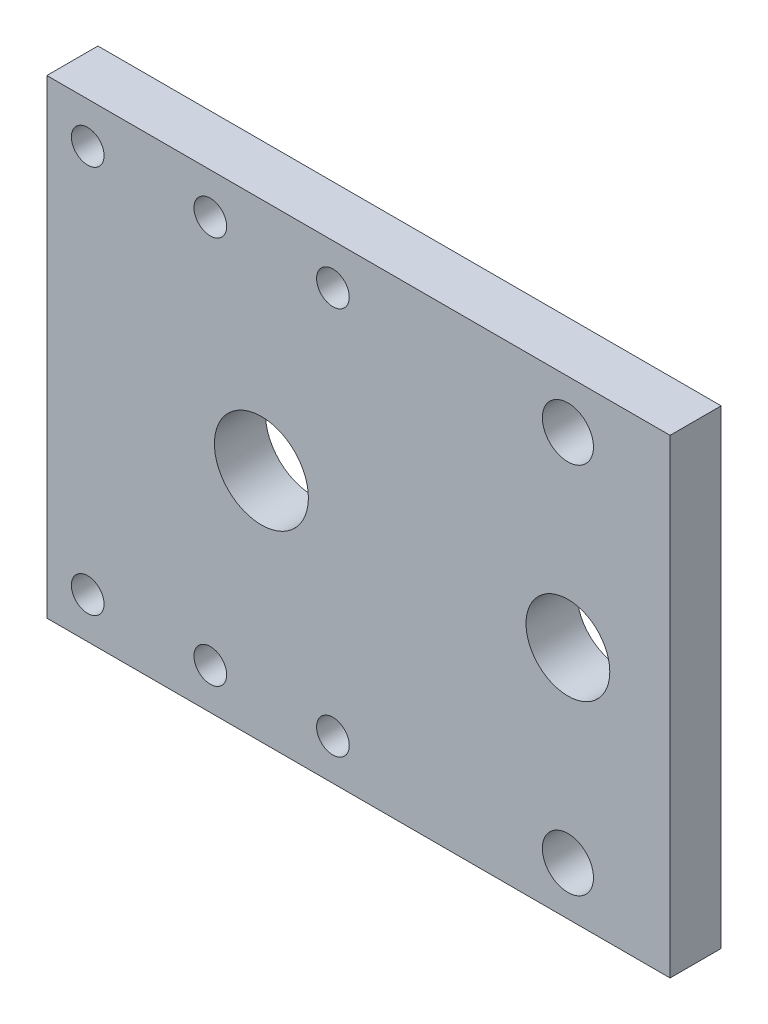
from build123d import *

# Parameters (mm, degrees)
SKETCH1_W           = 65
SKETCH1_H           = 46
SKETCH1_R           = 4.6
SKETCH1_R_2         = 2.5
BOSS_EXTRUDE1_DEPTH = 5
SKETCH2_R           = 1.6
CUT_EXTRUDE1_DEPTH  = 10
SKETCH3_W           = 4
SKETCH3_H           = 46
CUT_EXTRUDE2_DEPTH  = 47.411205543


with BuildPart() as part:
    # Sketch1 → Boss-Extrude1 (new body)
    with BuildSketch(Plane.XY):
        with Locations((7.5, 0)):
            Rectangle(SKETCH1_W, SKETCH1_H)
        Circle(SKETCH1_R, mode=Mode.SUBTRACT)
        with Locations((30, -18.25)):
            Circle(SKETCH1_R_2, mode=Mode.SUBTRACT)
        with BuildLine():
            ThreePointArc((34.1, 0), (27.100862197, -2.899137803), (30, 4.1))
            ThreePointArc((30, 4.1), (32.899137803, 2.899137803), (34.1, 0))
        make_face(mode=Mode.SUBTRACT)
        with BuildLine():
            ThreePointArc((32.5, 18.25), (31.767766953, 16.482233047), (30, 15.75))
            ThreePointArc((30, 15.75), (28.232233047, 20.017766953), (32.5, 18.25))
        make_face(mode=Mode.SUBTRACT)
    extrude(amount=BOSS_EXTRUDE1_DEPTH)

    # Sketch2 → Cut-Extrude1 (cut)
    with BuildSketch(Plane.XY.offset(5)):
        with Locations((7, 19)):
            Circle(SKETCH2_R)
        with Locations((-5, -19)):
            Circle(SKETCH2_R)
        with Locations((-17, 19)):
            Circle(SKETCH2_R)
        with Locations((-5, 19)):
            Circle(SKETCH2_R)
        with Locations((7, -19)):
            Circle(SKETCH2_R)
        with Locations((-17, -19)):
            Circle(SKETCH2_R)
    extrude(amount=-CUT_EXTRUDE1_DEPTH, mode=Mode.SUBTRACT)

    # Sketch3 → Cut-Extrude2 (cut, through all)
    with BuildSketch(Plane.XY.offset(5)):
        with Locations((-23, 0)):
            Rectangle(SKETCH3_W, SKETCH3_H)
    extrude(amount=-CUT_EXTRUDE2_DEPTH, mode=Mode.SUBTRACT)


solid = part.part
